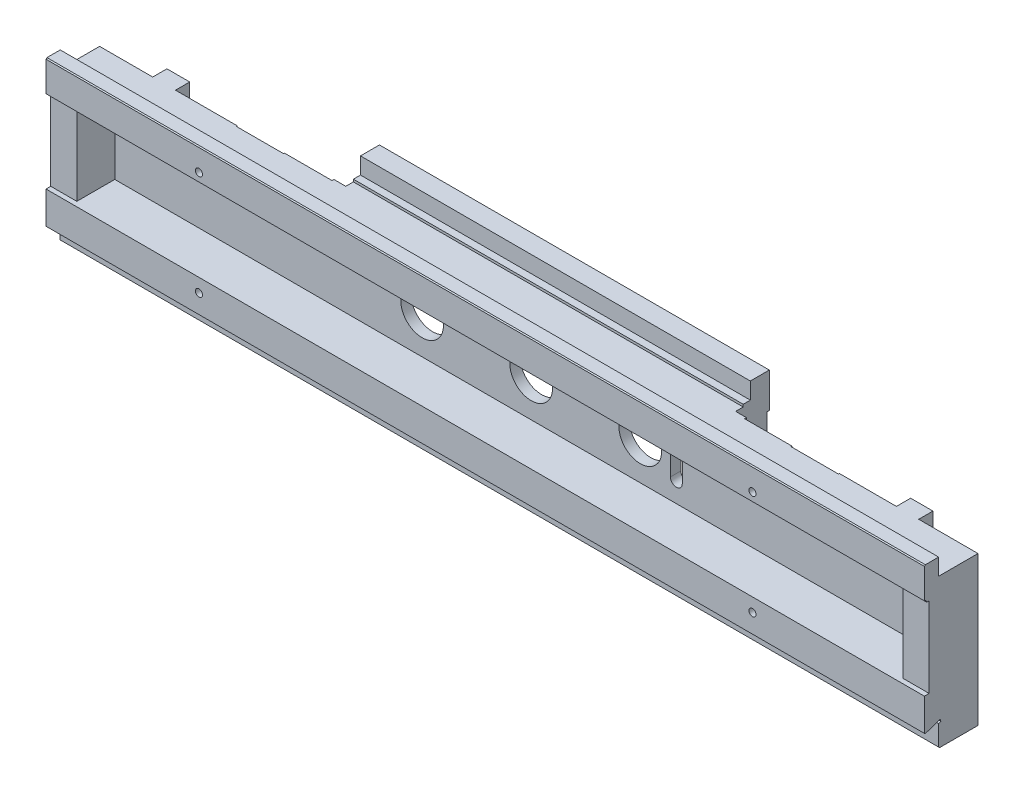
from build123d import *
from OCP.BRepFilletAPI import BRepFilletAPI_MakeChamfer

# Parameters (mm, degrees)
EXTRUDE_1_DEPTH      = 1852
FILLET_1_R           = 5
CHAMFER_1_SIZE       = 2
CHAMFER_1_SIZE2      = 1.574468085
EXTRUDE_2_DEPTH      = 822
SKETCH_5_W           = 47
SKETCH_5_H           = 314
EXTRUDE_3_DEPTH      = 30
SKETCH_7_W           = 100
SKETCH_7_H           = 314
CUT_EXTRUDE_1_DEPTH  = 2
SKETCH_8_W           = 23
SKETCH_8_H           = 314
EXTRUDE_4_DEPTH      = 4
SKETCH_9_W           = 48
SKETCH_9_H           = 314
EXTRUDE_5_DEPTH      = 30
SKETCH_10_W          = 100
SKETCH_10_H          = 314
CUT_EXTRUDE_2_DEPTH  = 2
SKETCH_11_W          = 25
SKETCH_11_H          = 314
EXTRUDE_6_DEPTH      = 4
SKETCH_12_W          = 1742
SKETCH_12_H          = 169.004058013
CUT_EXTRUDE_3_DEPTH  = 80
SKETCH_13_W          = 822
SKETCH_13_H          = 239
CUT_EXTRUDE_4_DEPTH  = 5
SKETCH_14_W          = 736
SKETCH_14_H          = 219
CUT_EXTRUDE_5_DEPTH  = 71
SKETCH_15_R          = 45
CUT_EXTRUDE_6_DEPTH  = 1884.868315719
SKETCH_16_W          = 736
SKETCH_16_H          = 41
CUT_EXTRUDE_7_DEPTH  = 20
SKETCH_17_R          = 7.5
CUT_EXTRUDE_8_DEPTH  = 30
SKETCH_18_R          = 7.5
CUT_EXTRUDE_9_DEPTH  = 113
SKETCH_21_R          = 7.5
CUT_EXTRUDE_11_DEPTH = 111
SKETCH_23_R          = 7.5
CUT_EXTRUDE_12_DEPTH = 111


with BuildPart() as part:
    # 草图2 → 凸台-拉伸1 (new body)
    with BuildSketch(Plane(origin=(0, 0, 0), x_dir=(0, 0, -1), z_dir=(1, 0, 0))):
        Polygon((-76.260223553, 62.638496495), (-46.260223553, 62.638496495), (-46.260223553, 27.638496495), (36.739776447, 27.638496495), (36.739776447, -286.361503505), (-46.260223553, -286.361503505), (-46.260223553, -241.361503505), (-41.530493824, -239.739881883), (-43.152115445, -235.010152153), (-76.260223553, -246.361503505), (-76.260223553, -176.361503505), (-66.260223553, -176.361503505), (-66.260223553, -7.357445492), (-71.260223553, -7.357445492), (-71.260223553, -2.361503505), (-76.260223553, -2.361503505), align=None)
    extrude(amount=EXTRUDE_1_DEPTH)

    # 圆角1
    # the kernel refuses this fillet: 5 mm, written as the material it adds along each edge
    with BuildSketch(Plane(origin=(0, -2.361503505, 71.260223553), x_dir=(0, -1, 0), z_dir=(1, 0, 0))) as fillet_1_piece_1_section:
        with BuildLine():
            CenterArc((FILLET_1_R, -FILLET_1_R), FILLET_1_R, 90, 90)
            Line((0, -FILLET_1_R), (0, 0))
            Line((0, 0), (FILLET_1_R, 0))
        make_face()
    fillet_1_piece_1 = extrude(amount=1852, mode=Mode.PRIVATE)
    fillet_1_piece_1 = split(fillet_1_piece_1, bisect_by=Plane(origin=(926, -7.357445492, 72.392274368), z_dir=(0, 1, 0)), keep=Keep.TOP, mode=Mode.PRIVATE)
    add(fillet_1_piece_1)

    # 倒角1: one chamfer whose edges measure the first distance from different faces: ONE call of the kernel's chamfer builder (chamfer() names one face for all edges)
    chamfer_1_edges_1 = [part.edges().sort_by_distance(p)[0] for p in [
        (926, 62.638496495, 76.260223553),
        (926, -286.361503505, 46.260223553),
    ]]
    chamfer_1_edges_2 = [part.edges().sort_by_distance(p)[0] for p in [
        (926, -246.361503505, 76.260223553),
    ]]
    chamfer_1_side_2 = [part.faces().sort_by_distance(p)[0] for p in [
        (926, -211.361503505, 76.260223553),
    ]]
    chamfer_1 = BRepFilletAPI_MakeChamfer(part.part.solid().wrapped)
    for e in chamfer_1_edges_1:
        chamfer_1.Add(CHAMFER_1_SIZE, e.wrapped)
    for e in chamfer_1_edges_2:
        chamfer_1.Add(CHAMFER_1_SIZE, CHAMFER_1_SIZE2, e.wrapped, chamfer_1_side_2[0].wrapped)  # the first distance lies on this face
    add(Compound.cast(chamfer_1.Shape()), mode=Mode.REPLACE)

    # 草图4 → 凸台-拉伸2 (add)
    with BuildSketch(Plane(origin=(1337, 0, 0), x_dir=(0, 0, -1), z_dir=(1, 0, 0))):
        Polygon((36.739776447, 27.638496495), (56.739776447, 27.638496495), (56.739776447, 32.638496495), (71.739776447, 32.638496495), (71.739776447, 67.638496495), (111.739776447, 67.638496495), (111.739776447, -326.361503505), (71.739776447, -326.361503505), (71.739776447, -291.361503505), (56.739776447, -291.361503505), (56.739776447, -286.361503505), (36.739776447, -286.361503505), align=None)
    extrude(amount=-EXTRUDE_2_DEPTH)

    # 草图5 → 凸台-拉伸3 (add)
    with BuildSketch(Plane(origin=(0, 0, -36.739776447), x_dir=(-1, 0, 0), z_dir=(0, 0, -1))):
        with Locations((-1703.5, -129.361503505)):
            Rectangle(SKETCH_5_W, SKETCH_5_H)
    extrude(amount=EXTRUDE_3_DEPTH)

    # 草图7 → 切除-拉伸1 (cut)
    with BuildSketch(Plane(origin=(0, 0, -36.739776447), x_dir=(-1, 0, 0), z_dir=(0, 0, -1))):
        with Locations((-1510, -129.361503505)):
            Rectangle(SKETCH_7_W, SKETCH_7_H)
    extrude(amount=-CUT_EXTRUDE_1_DEPTH, mode=Mode.SUBTRACT)

    # 草图8 → 凸台-拉伸4 (add)
    with BuildSketch(Plane(origin=(0, 0, -36.739776447), x_dir=(-1, 0, 0), z_dir=(0, 0, -1))):
        with Locations((-1348.5, -129.361503505)):
            Rectangle(SKETCH_8_W, SKETCH_8_H)
    extrude(amount=EXTRUDE_4_DEPTH)

    # 草图9 → 凸台-拉伸5 (add)
    with BuildSketch(Plane(origin=(0, 0, -36.739776447), x_dir=(-1, 0, 0), z_dir=(0, 0, -1))):
        with Locations((-136, -129.361503505)):
            Rectangle(SKETCH_9_W, SKETCH_9_H)
    extrude(amount=EXTRUDE_5_DEPTH)

    # 草图10 → 切除-拉伸2 (cut)
    with BuildSketch(Plane(origin=(0, 0, -36.739776447), x_dir=(-1, 0, 0), z_dir=(0, 0, -1))):
        with Locations((-340, -129.361503505)):
            Rectangle(SKETCH_10_W, SKETCH_10_H)
    extrude(amount=-CUT_EXTRUDE_2_DEPTH, mode=Mode.SUBTRACT)

    # 草图11 → 凸台-拉伸6 (add)
    with BuildSketch(Plane(origin=(0, 0, -36.739776447), x_dir=(-1, 0, 0), z_dir=(0, 0, -1))):
        with Locations((-502.5, -129.361503505)):
            Rectangle(SKETCH_11_W, SKETCH_11_H)
    extrude(amount=EXTRUDE_6_DEPTH)

    # 草图12 → 切除-拉伸3 (cut)
    with BuildSketch(Plane.XY.offset(66.260223553)):
        with Locations((926, -91.859474499)):
            Rectangle(SKETCH_12_W, SKETCH_12_H)
    extrude(amount=-CUT_EXTRUDE_3_DEPTH, mode=Mode.SUBTRACT)

    # 草图13 → 切除-拉伸4 (cut)
    with BuildSketch(Plane(origin=(0, 0, -111.739776447), x_dir=(-1, 0, 0), z_dir=(0, 0, -1))):
        with Locations((-926, -125.861503505)):
            Rectangle(SKETCH_13_W, SKETCH_13_H)
    extrude(amount=-CUT_EXTRUDE_4_DEPTH, mode=Mode.SUBTRACT)

    # 草图14 → 切除-拉伸5 (cut)
    with BuildSketch(Plane(origin=(0, 0, -106.739776447), x_dir=(-1, 0, 0), z_dir=(0, 0, -1))):
        with Locations((-926, -125.861503505)):
            Rectangle(SKETCH_14_W, SKETCH_14_H)
    extrude(amount=-CUT_EXTRUDE_5_DEPTH, mode=Mode.SUBTRACT)

    # 草图15 → 切除-拉伸6 (cut, through all)
    with BuildSketch(Plane(origin=(0, 0, -35.739776447), x_dir=(-1, 0, 0), z_dir=(0, 0, -1))):
        with Locations(Location((-1163, -96.361503505, 0), (0, 0, 90))):
            Circle(SKETCH_15_R)
        with Locations(Location((-933, -96.361503505, 0), (0, 0, 90))):
            Circle(SKETCH_15_R)
        with Locations(Location((-703, -96.361503505, 0), (0, 0, 90))):
            Circle(SKETCH_15_R)
        with BuildLine():
            Line((-1226.5, -48.861503505), (-1226.5, -133.861503505))
            ThreePointArc((-1226.5, -133.861503505), (-1239, -146.361503505), (-1251.5, -133.861503505))
            Line((-1251.5, -133.861503505), (-1251.5, -48.861503505))
            ThreePointArc((-1251.5, -48.861503505), (-1239, -36.361503505), (-1226.5, -48.861503505))
        make_face()
    extrude(amount=-CUT_EXTRUDE_6_DEPTH, mode=Mode.SUBTRACT)

    # 草图16 → 切除-拉伸7 (cut)
    with BuildSketch(Plane(origin=(0, -235.361503505, 0), x_dir=(1, 0, 0), z_dir=(0, 1, 0))):
        with Locations((926, 56.239776447)):
            Rectangle(SKETCH_16_W, SKETCH_16_H)
    extrude(amount=-CUT_EXTRUDE_7_DEPTH, mode=Mode.SUBTRACT)

    # 草图17 → 切除-拉伸8 (cut)
    with BuildSketch(Plane(origin=(0, 0, -66.739776447), x_dir=(-1, 0, 0), z_dir=(0, 0, -1))):
        with Locations(Location((-1707, -2.361503505, 0), (0, 0, 90))):
            Circle(SKETCH_17_R)
        with Locations(Location((-1707, -132.361503505, 0), (0, 0, 90))):
            Circle(SKETCH_17_R)
        with Locations(Location((-1707, -262.361503505, 0), (0, 0, 90))):
            Circle(SKETCH_17_R)
        with Locations(Location((-132, -2.361503505, 0), (0, 0, 90))):
            Circle(SKETCH_17_R)
        with Locations(Location((-132, -132.361503505, 0), (0, 0, 90))):
            Circle(SKETCH_17_R)
        with Locations(Location((-132, -262.361503505, 0), (0, 0, 90))):
            Circle(SKETCH_17_R)
    extrude(amount=-CUT_EXTRUDE_8_DEPTH, mode=Mode.SUBTRACT)

    # 草图18 → 切除-拉伸9 (cut)
    with BuildSketch(Plane(origin=(0, 0, -36.739776447), x_dir=(-1, 0, 0), z_dir=(0, 0, -1))):
        with Locations(Location((-1489.500000001, 15.138496495, 0), (0, 0, 90))):
            Circle(SKETCH_18_R)
    extrude(amount=-CUT_EXTRUDE_9_DEPTH, mode=Mode.SUBTRACT)

    # 草图21 → 切除-拉伸11 (cut)
    with BuildSketch(Plane(origin=(0, 0, -34.739776447), x_dir=(-1, 0, 0), z_dir=(0, 0, -1))):
        with Locations(Location((-322.5, 15.138496495, 0), (0, 0, 90))):
            Circle(SKETCH_21_R)
    extrude(amount=-CUT_EXTRUDE_11_DEPTH, mode=Mode.SUBTRACT)

    # 草图23 → 切除-拉伸12 (cut)
    with BuildSketch(Plane(origin=(0, 0, -34.739776447), x_dir=(-1, 0, 0), z_dir=(0, 0, -1))):
        with Locations(Location((-1489.500000001, -204.861503505, 0), (0, 0, 90))):
            Circle(SKETCH_23_R)
        with Locations(Location((-322.5, -204.861503505, 0), (0, 0, 90))):
            Circle(SKETCH_23_R)
    extrude(amount=-CUT_EXTRUDE_12_DEPTH, mode=Mode.SUBTRACT)


solid = part.part
